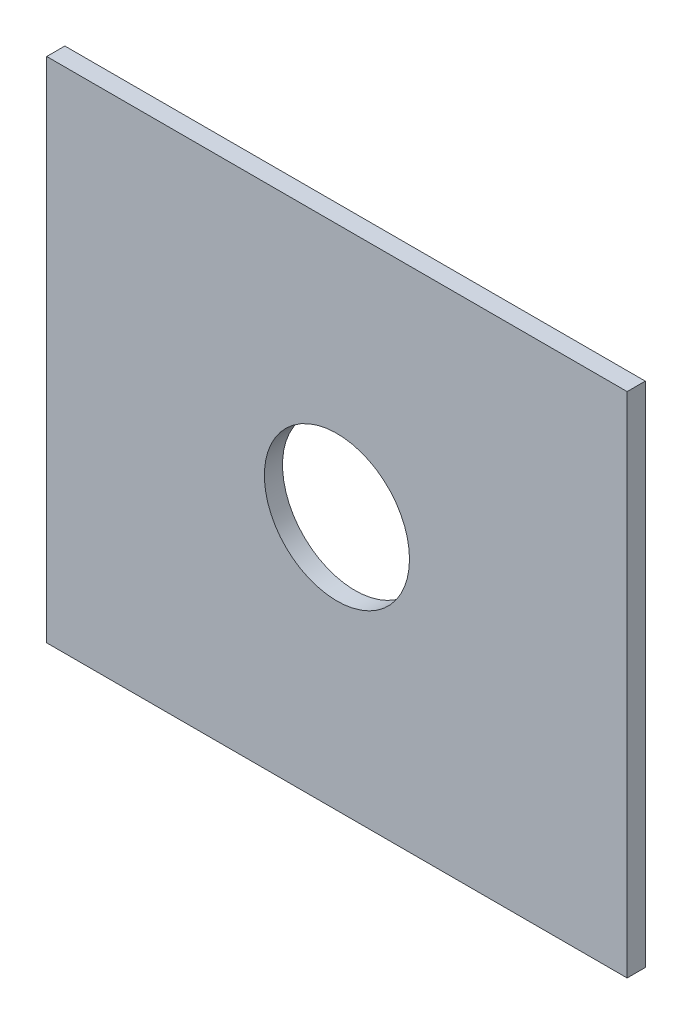
from build123d import *

# Parameters (mm, degrees)
SKETCH1_W          = 50.8
SKETCH1_H          = 44.45
EXTRUDE1_DEPTH     = 1.5875
SKETCH2_R          = 6.35
CUT_EXTRUDE1_DEPTH = 59.241997841


with BuildPart() as part:
    # Sketch1 → Extrude1 (new body)
    with BuildSketch(Plane.XY):
        with Locations((0, 30.1625)):
            Rectangle(SKETCH1_W, SKETCH1_H)
    extrude(amount=EXTRUDE1_DEPTH)

    # Sketch2 → Cut-Extrude1 (cut, through all)
    with BuildSketch(Plane.XY.offset(1.5875)):
        with Locations((0, 30.1625)):
            Circle(SKETCH2_R)
    extrude(amount=-CUT_EXTRUDE1_DEPTH, mode=Mode.SUBTRACT)


solid = part.part
